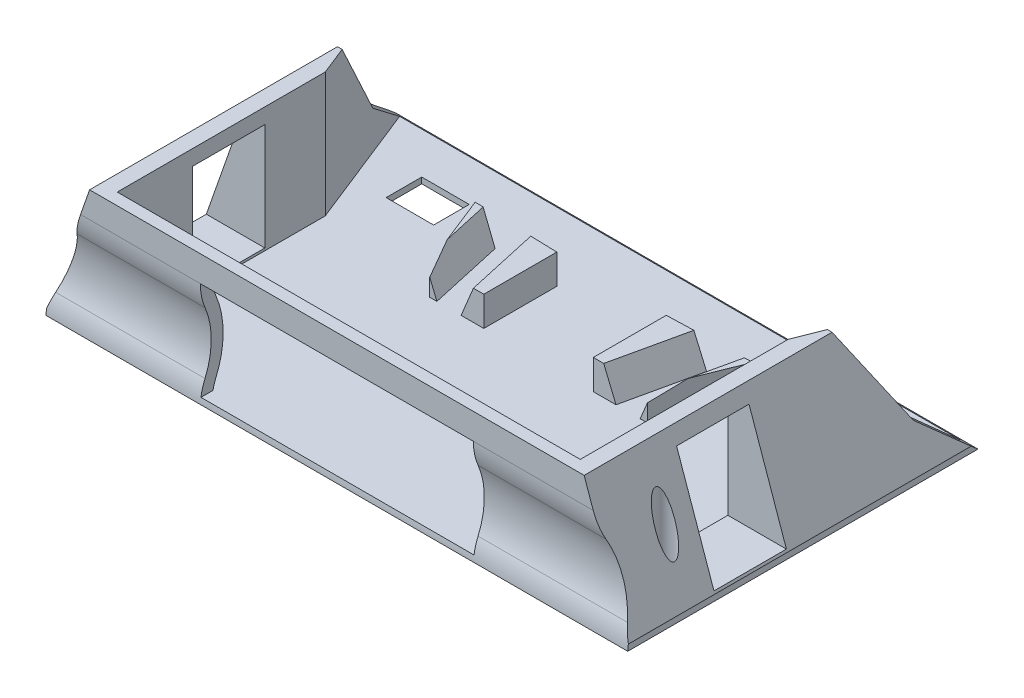
from build123d import *
from OCP.BRepFilletAPI import BRepFilletAPI_MakeChamfer
from build123d.topology import SkipClean

# Parameters (mm, degrees)
CROQUIS1_W              = 98
CROQUIS1_H              = 60
SALIENTE_EXTRUIR1_DEPTH = 1
CROQUIS2_W              = 12.2
CROQUIS2_H              = 18
SALIENTE_EXTRUIR2_DEPTH = 10
SALIENTE_EXTRUIR3_START = -88
CROQUIS2_3_W            = 12.2
CROQUIS2_3_H            = 18
SALIENTE_EXTRUIR3_DEPTH = 10
CORTAR_EXTRUIR1_DEPTH   = 115
CORTAR_EXTRUIR2_DEPTH   = 115
REDONDEO1_R             = 10
REDONDEO2_START         = -43
REDONDEO2_DEPTH         = 100
CROQUIS4_R              = 1.624451876
CROQUIS4_W              = 8
CROQUIS4_H              = 6
CORTAR_EXTRUIR3_DEPTH   = 41
SALIENTE_EXTRUIR4_DEPTH = 5
CHAFL_N1_SIZE           = 5
CHAFL_N1_SIZE_2         = 2.020131129
CORTAR_EXTRUIR4_DEPTH   = 101
SALIENTE_EXTRUIR5_DEPTH = 26
SALIENTE_EXTRUIR6_START = -72
SALIENTE_EXTRUIR6_DEPTH = 26
CORTAR_EXTRUIR5_DEPTH   = 72
SALIENTE_EXTRUIR7_START = -88
CROQUIS7_5_W            = 2
CROQUIS7_5_H            = 4.363894299
SALIENTE_EXTRUIR7_DEPTH = 78


with BuildPart() as part:
    # Croquis1 → Saliente-Extruir1 (new body)
    with BuildSketch(Plane(origin=(0, 0, 0), x_dir=(1, 0, 0), z_dir=(0, 1, 0))):
        with Locations((7.309859155, 2.323943662)):
            Rectangle(CROQUIS1_W, CROQUIS1_H)
    extrude(amount=SALIENTE_EXTRUIR1_DEPTH)

    # Croquis2 → Saliente-Extruir2 (add)
    with BuildSketch(Plane.ZY.offset(41.690140845)):
        with BuildLine():
            Line((-22.673615367, 7.404257104), (-31.02059504, 1))
            Line((-31.02059504, 1), (27.676056338, 1))
            Line((27.676056338, 1), (27.676056338, 1.85662729))
            ThreePointArc((27.676056338, 1.85662729), (25.837285222, 8.581073785), (27.676056338, 15.305520281))
            Line((27.676056338, 15.305520281), (27.676056338, 22))
            Line((27.676056338, 22), (-14.080479284, 22))
            Line((-14.080479284, 22), (-22.673615367, 7.404257104))
        make_face()
        with Locations((6.911108061, 10.408932756)):
            Rectangle(CROQUIS2_W, CROQUIS2_H, mode=Mode.SUBTRACT)
    extrude(amount=-SALIENTE_EXTRUIR2_DEPTH)

    # Croquis2<3> → Saliente-Extruir3 (add)
    with BuildSketch(Plane.ZY.offset(41.690140845).offset(SALIENTE_EXTRUIR3_START)):
        with BuildLine():
            Line((-22.673615367, 7.404257104), (-31.02059504, 1))
            Line((-31.02059504, 1), (27.676056338, 1))
            Line((27.676056338, 1), (27.676056338, 1.85662729))
            ThreePointArc((27.676056338, 1.85662729), (25.837285222, 8.581073785), (27.676056338, 15.305520281))
            Line((27.676056338, 15.305520281), (27.676056338, 22))
            Line((27.676056338, 22), (-14.080479284, 22))
            Line((-14.080479284, 22), (-22.673615367, 7.404257104))
        make_face()
        with Locations((6.911108061, 10.408932756)):
            Rectangle(CROQUIS2_3_W, CROQUIS2_3_H, mode=Mode.SUBTRACT)
    extrude(amount=-SALIENTE_EXTRUIR3_DEPTH)

    # Croquis2<4> → Cortar-Extruir1 (cut)
    with BuildSketch(Plane.ZY.offset(41.690140845)):
        Polygon((-32.323943662, 1), (-32.323943662, 0), (-31.02059504, 1), align=None)
    extrude(amount=-CORTAR_EXTRUIR1_DEPTH, mode=Mode.SUBTRACT)

    # Croquis3 → Cortar-Extruir2 (cut)
    with BuildSketch(Plane(origin=(0, 1, 0), x_dir=(1, 0, 0), z_dir=(0, 1, 0))):
        Polygon((-40.291413083, 31.02059504), (-31.690140845, 9.370184618), (-31.690140845, 31.02059504), align=None)
        Polygon((54.911131393, 31.02059504), (46.309859155, 31.02059504), (46.309859155, 9.370184618), align=None)
    extrude(amount=CORTAR_EXTRUIR2_DEPTH, mode=Mode.SUBTRACT)

    # Redondeo1
    # the kernel refuses this fillet: 10 mm, written as the material it takes off along each edge
    # the kernel refuses this fillet: 10 mm, written as the material it takes off along each edge
    with BuildSketch(Plane(origin=(-46.33170907, 1.85662729, 27.676056338), x_dir=(0, 0.8924889538837264, -0.4510692487806408), z_dir=(1, 0, 0))) as redondeo1_2_piece_1:
        with BuildLine():
            CenterArc((2.398228131, -9.978308132), REDONDEO1_R, 93.774545272, 20.149469447)
            Line((-1.657019348, -0.837467477), (0, 0))
            ThreePointArc((0, 0), (0.869961056, -0.028666121), (1.739922113, 0))
        make_face()
    extrude(amount=19.283136451, mode=Mode.SUBTRACT)
    # the kernel refuses this fillet: 10 mm, written as the material it takes off along each edge
    # the kernel refuses this fillet: 10 mm, written as the material it takes off along each edge
    with BuildSketch(Plane(origin=(41.66829093, 1.85662729, 27.676056338), x_dir=(0, -1, 0), z_dir=(1, 0, 0))) as redondeo1_4_piece_1:
        with BuildLine():
            CenterArc((2.360515838, 9.987296748), REDONDEO1_R, 246.962238713, 20.149469447)
            ThreePointArc((-1.552861266, 0.78482536), (-0.763500227, 0.417996876), (0, 0))
            Line((0, 0), (1.85662729, 0))
        make_face()
    extrude(amount=19.283136451, mode=Mode.SUBTRACT)
    # the kernel refuses this fillet: 10 mm, written as the material it takes off along each edge
    with BuildSketch(Plane(origin=(52.565538288, 1, 27.676056338), x_dir=(0, -1, 0), z_dir=(-1, 0, 0))) as redondeo1_5_piece_1_section:
        with BuildLine():
            CenterArc((10, -4.358898944), REDONDEO1_R, 154.158067237, 25.841932763)
            Line((0, -4.358898944), (0, 0))
            Line((0, 0), (1, 0))
        make_face()
    redondeo1_5_piece_1 = extrude(amount=90.511358267, mode=Mode.PRIVATE)
    redondeo1_5_piece_1 = redondeo1_5_piece_1 - Plane(origin=(52.565538288, -0.503888548, 17.68875959), x_dir=(0, 0.050388854784132256, 0.998729674793707), z_dir=(-1, 0, 0)) * Cylinder(10, 199, mode=Mode.PRIVATE)
    add(redondeo1_5_piece_1, mode=Mode.SUBTRACT)

    # Redondeo2: read off the stored shape, not the designer's step
    # Redondeo2 outline → Redondeo2 (cut)
    with SkipClean():  # the faces are left unmerged after this step: merging them gives an invalid solid
        with BuildSketch(Plane.YZ.offset(REDONDEO2_START)):
            with BuildLine():
                ThreePointArc((13.735621222, 26.883999693), (15.646059665, 27.476041888), (17.636105701, 27.676056338))
                Line((17.636105701, 27.676056338), (15.305520281, 27.676056338))
                ThreePointArc((15.305520281, 27.676056338), (14.533759116, 27.253887965), (13.735621222, 26.883999693))
            make_face()
        extrude(amount=REDONDEO2_DEPTH, mode=Mode.SUBTRACT)
    add(part.part.scale(1), mode=Mode.REPLACE)  # the faces are merged on a copy

    # Croquis4 → Cortar-Extruir3 (cut)
    with BuildSketch(Plane.XZ):
        with Locations(Location((-37.960140845, 17.674595399, 0), (0, 0, 270))):
            Circle(CROQUIS4_R)
        with Locations(Location((52.579859155, 17.674595399, 0), (0, 0, 270))):
            Circle(CROQUIS4_R)
        with Locations((-25.233647173, -20.164268386)):
            Rectangle(CROQUIS4_W, CROQUIS4_H)
        with Locations((39.853365482, -20.164268386)):
            Rectangle(CROQUIS4_W, CROQUIS4_H)
    extrude(amount=-CORTAR_EXTRUIR3_DEPTH, mode=Mode.SUBTRACT)

    # Croquis5 → Saliente-Extruir4 (add)
    with BuildSketch(Plane(origin=(0, 1, 0), x_dir=(1, 0, 0), z_dir=(0, 1, 0))):
        Polygon((-1.913897366, 6.29786762), (-1.913897366, 18.591303013), (-8.5088233, 18.784914739), (-5.73410883, 6.29786762), align=None)
        Polygon((-9.811245677, 6.29786762), (-12.612731972, 18.905395977), (-16.070794085, 19.006916659), (-11.021744735, 6.29786762), align=None)
        Polygon((16.533615676, 18.591303013), (16.533615676, 6.29786762), (20.35382714, 6.29786762), (23.12854161, 18.784914739), align=None)
        Polygon((27.232450282, 18.905395977), (24.430963987, 6.29786762), (25.641463045, 6.29786762), (30.690512395, 19.006916659), align=None)
    extrude(amount=SALIENTE_EXTRUIR4_DEPTH)

    # Chaflán1
    chafl_n1_edges_1 = [part.edges().sort_by_distance(p)[0] for p in [
        (25.831707134, 6, -12.601631799),
    ]]
    chafl_n1_side_1 = [part.faces().sort_by_distance(p)[0] for p in [
        (25.831707134, 5.959597377, -12.601631799),
    ]]
    chafl_n1_edges_2 = [part.edges().sort_by_distance(p)[0] for p in [
        (21.741184375, 6, -12.541391179),
    ]]
    chafl_n1_side_2 = [part.faces().sort_by_distance(p)[0] for p in [
        (21.741184375, 5.959597377, -12.541391179),
    ]]
    chafl_n1_edges_3 = [part.edges().sort_by_distance(p)[0] for p in [
        (-11.211988825, 6, -12.601631799),
    ]]
    chafl_n1_side_3 = [part.faces().sort_by_distance(p)[0] for p in [
        (-11.211988825, 5.959597377, -12.601631799),
    ]]
    chafl_n1_edges_4 = [part.edges().sort_by_distance(p)[0] for p in [
        (-7.121466065, 6, -12.541391179),
    ]]
    chafl_n1_side_4 = [part.faces().sort_by_distance(p)[0] for p in [
        (-7.121466065, 5.959597377, -12.541391179),
    ]]
    chafl_n1 = BRepFilletAPI_MakeChamfer(part.part.solid().wrapped)
    for e in chafl_n1_edges_1:
        chafl_n1.Add(CHAFL_N1_SIZE - 0.0001, CHAFL_N1_SIZE_2 - 0.0001, e.wrapped, chafl_n1_side_1[0].wrapped)
    for e in chafl_n1_edges_2:
        chafl_n1.Add(CHAFL_N1_SIZE - 0.0001, CHAFL_N1_SIZE_2 - 0.0001, e.wrapped, chafl_n1_side_2[0].wrapped)
    for e in chafl_n1_edges_3:
        chafl_n1.Add(CHAFL_N1_SIZE - 0.0001, CHAFL_N1_SIZE_2 - 0.0001, e.wrapped, chafl_n1_side_3[0].wrapped)
    for e in chafl_n1_edges_4:
        chafl_n1.Add(CHAFL_N1_SIZE - 0.0001, CHAFL_N1_SIZE_2 - 0.0001, e.wrapped, chafl_n1_side_4[0].wrapped)
    add(Compound.cast(chafl_n1.Shape()), mode=Mode.REPLACE)  # a hair under: the kernel refuses the full size

    # Croquis6 → Cortar-Extruir4 (cut)
    with BuildSketch(Plane.ZY.offset(41.690140845)):
        Polygon((-22.673615367, 7.404257104), (-31.323943662, 0), (-32.323943662, 0), align=None)
    extrude(amount=-CORTAR_EXTRUIR4_DEPTH, mode=Mode.SUBTRACT)

    # Croquis7 → Saliente-Extruir5 (add)
    with BuildSketch(Plane.ZY.offset(41.690140845)):
        with BuildLine():
            Line((27.676056338, 17.636105701), (25.676056338, 17.636105701))
            ThreePointArc((25.676056338, 17.636105701), (25.516044778, 16.044068872), (25.042411022, 14.515718118))
            ThreePointArc((25.042411022, 14.515718118), (23.837288952, 8.570418777), (25.0507367, 2.626813135))
            ThreePointArc((25.0507367, 2.626813135), (25.473403095, 1.339837436), (25.67287484, 0))
            Line((25.67287484, 0), (27.676056338, 0))
            ThreePointArc((27.676056338, 0), (27.433909837, 1.739333838), (26.891230978, 3.409488556))
            ThreePointArc((26.891230978, 3.409488556), (25.837288462, 8.571819356), (26.883999693, 13.735621222))
            ThreePointArc((26.883999693, 13.735621222), (27.476041888, 15.646059665), (27.676056338, 17.636105701))
        make_face()
    extrude(amount=-SALIENTE_EXTRUIR5_DEPTH)

    # Croquis7<4> → Saliente-Extruir6 (add)
    with BuildSketch(Plane.ZY.offset(41.690140845).offset(SALIENTE_EXTRUIR6_START)):
        with BuildLine():
            Line((27.676056338, 17.636105701), (25.676056338, 17.636105701))
            ThreePointArc((25.676056338, 17.636105701), (25.516044778, 16.044068872), (25.042411022, 14.515718118))
            ThreePointArc((25.042411022, 14.515718118), (23.837288952, 8.570418777), (25.0507367, 2.626813135))
            ThreePointArc((25.0507367, 2.626813135), (25.473403095, 1.339837436), (25.67287484, 0))
            Line((25.67287484, 0), (27.676056338, 0))
            ThreePointArc((27.676056338, 0), (27.433909837, 1.739333838), (26.891230978, 3.409488556))
            ThreePointArc((26.891230978, 3.409488556), (25.837288462, 8.571819356), (26.883999693, 13.735621222))
            ThreePointArc((26.883999693, 13.735621222), (27.476041888, 15.646059665), (27.676056338, 17.636105701))
        make_face()
    extrude(amount=-SALIENTE_EXTRUIR6_DEPTH)

    # Croquis8 → Cortar-Extruir5 (cut)
    with BuildSketch(Plane.XY.offset(27.676056338)):
        Polygon((-43.181006637, 23.333071417), (-41.690140845, 1), (-35.872500086, 17.636105701), (-41.690140845, 17.636105701), (-41.690140845, 22), (-34.346447667, 22), align=None)
        Polygon((-41.690140845, 17.636105701), (-35.872500086, 17.636105701), (-34.346447667, 22), (-41.690140845, 22), align=None)
        Polygon((57.800724947, 23.333071417), (56.309859155, 1), (48.966165977, 22), align=None)
    extrude(amount=-CORTAR_EXTRUIR5_DEPTH, mode=Mode.SUBTRACT)

    # Croquis7<5> → Saliente-Extruir7 (add)
    with BuildSketch(Plane.ZY.offset(41.690140845).offset(SALIENTE_EXTRUIR7_START)):
        with Locations((26.676056338, 19.818052851)):
            Rectangle(CROQUIS7_5_W, CROQUIS7_5_H)
    extrude(amount=SALIENTE_EXTRUIR7_DEPTH)


solid = part.part
